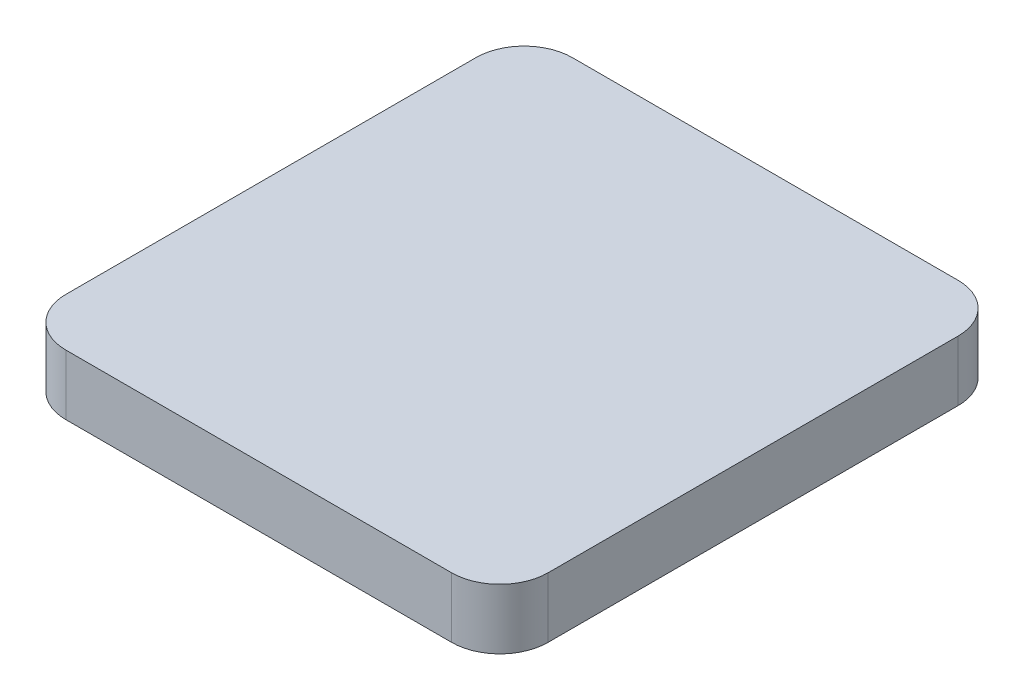
from build123d import *

# Parameters (mm, degrees)
SKETCH1_W           = 25.4
SKETCH1_H           = 26.68
BOSS_EXTRUDE1_DEPTH = 3.175
FILLET1_R           = 2.54


with BuildPart() as part:
    # Sketch1 → Boss-Extrude1 (new body)
    with BuildSketch(Plane(origin=(0, 0, 0), x_dir=(1, 0, 0), z_dir=(0, 1, 0))):
        with Locations((12.7, 13.34)):
            Rectangle(SKETCH1_W, SKETCH1_H)
    extrude(amount=BOSS_EXTRUDE1_DEPTH)

    # Fillet1
    fillet1_edges = [part.edges().sort_by_distance(p)[0] for p in [
        (0, 1.5875, -26.68),
        (25.4, 1.5875, -26.68),
        (25.4, 1.5875, 0),
        (0, 1.5875, 0),
    ]]
    fillet(fillet1_edges, radius=FILLET1_R)


solid = part.part
